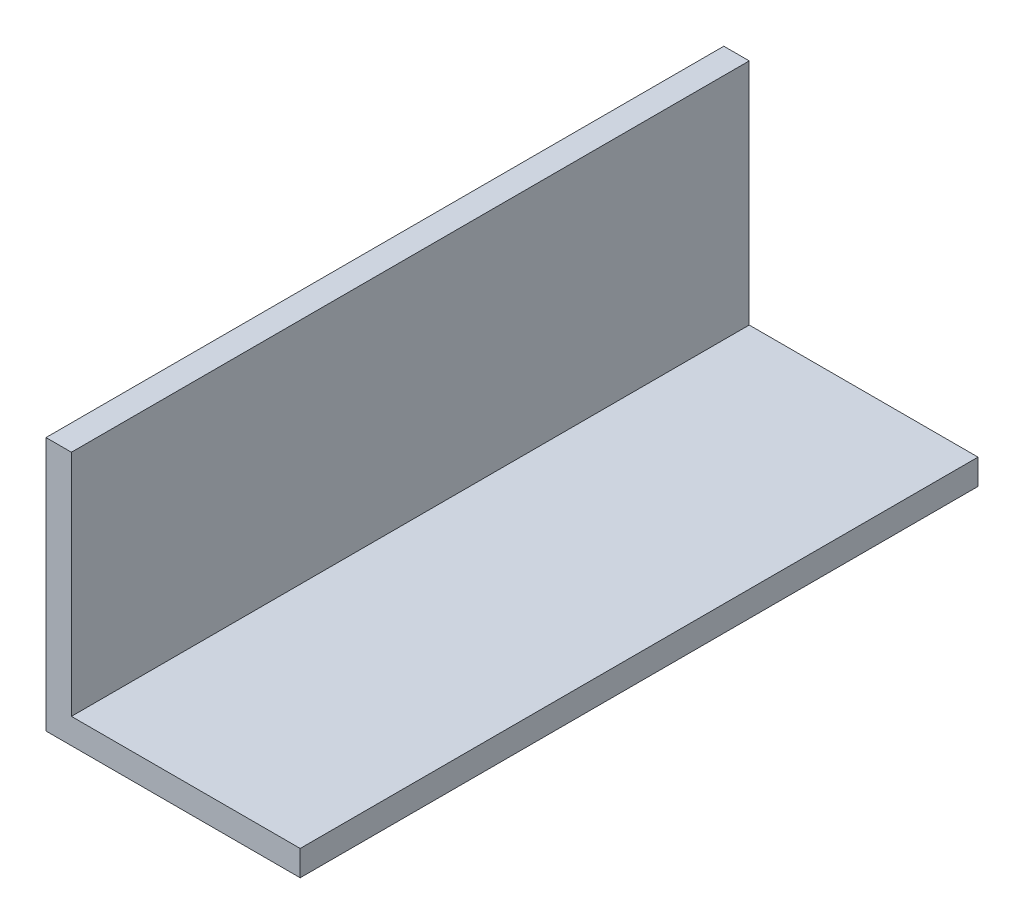
from build123d import *

# Parameters (mm, degrees)
EXTRUDE_1_DEPTH = 80


with BuildPart() as part:
    # Эскиз1 → Бобышка-Вытянуть1 (new body)
    with BuildSketch(Plane.XY):
        Polygon((0, 30), (0, 0), (30, 0), (30, 3), (3, 3), (3, 30), align=None)
    extrude(amount=EXTRUDE_1_DEPTH)


solid = part.part
